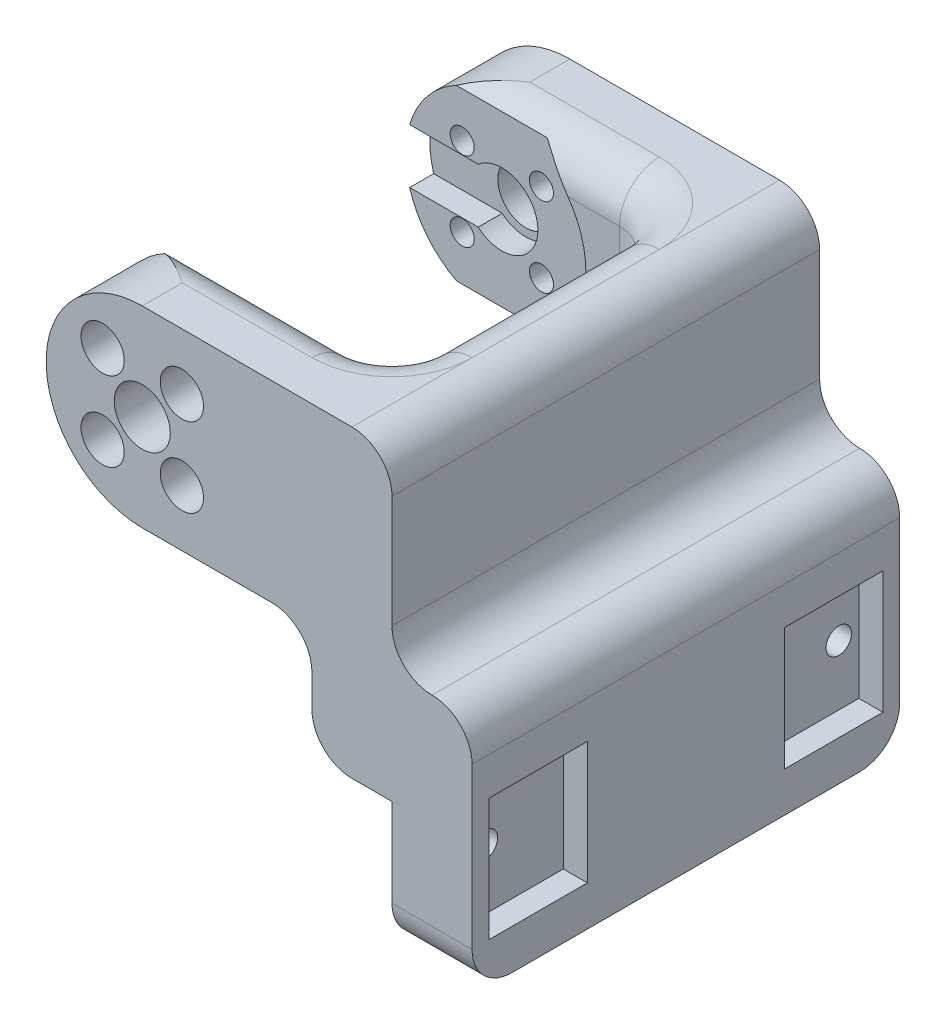
from build123d import *

# Parameters (mm, degrees)
EXTRUDE_1_DEPTH      = 13.5
SKETCH_5_R           = 10.1
CUT_EXTRUDE_2_DEPTH  = 1.5
SKETCH_7_R           = 3.5
CUT_EXTRUDE_3_DEPTH  = 37
SKETCH_35_R          = 4.5
CUT_EXTRUDE_22_DEPTH = 3
SKETCH_9_R           = 1.5
CUT_EXTRUDE_4_DEPTH  = 24.5
SKETCH_11_W          = 60.4
SKETCH_11_H          = 24
EXTRUDE_2_DEPTH      = 10
SKETCH_12_R          = 2.7
CUT_EXTRUDE_5_DEPTH  = 8.5
SKETCH_18_R          = 12
CUT_EXTRUDE_9_DEPTH  = 1.5
SKETCH_19_W          = 16.628747166
SKETCH_19_H          = 6.8
CUT_EXTRUDE_10_DEPTH = 3
SKETCH_20_W          = 76.507524202
SKETCH_20_H          = 37.102074034
CUT_EXTRUDE_11_DEPTH = 3.5
SKETCH_21_W          = 10
SKETCH_21_H          = 53.4
EXTRUDE_3_DEPTH      = 30
SKETCH_22_W          = 53.4
SKETCH_22_H          = 54
EXTRUDE_4_DEPTH      = 15
SKETCH_24_W          = 12.3
SKETCH_24_H          = 15.3
CUT_EXTRUDE_12_DEPTH = 3
SKETCH_26_R          = 1.6
CUT_EXTRUDE_14_DEPTH = 15
SKETCH_27_W          = 15
SKETCH_27_H          = 53.4
CUT_EXTRUDE_15_DEPTH = 24
SKETCH_25_W          = 53.4
SKETCH_25_H          = 16
CUT_EXTRUDE_16_DEPTH = 15
SKETCH_28_W          = 53.4
SKETCH_28_H          = 16
SKETCH_28_R          = 1.6
EXTRUDE_5_DEPTH      = 10
SKETCH_29_W          = 12.3
SKETCH_29_H          = 15.3
SKETCH_29_R          = 1.6
CUT_EXTRUDE_17_DEPTH = 10
SKETCH_30_W          = 53.4
SKETCH_30_H          = 30
CUT_EXTRUDE_18_DEPTH = 10
EXTRUDE_6_DEPTH      = 5
SKETCH_32_W          = 53.4
SKETCH_32_H          = 24
CUT_EXTRUDE_19_DEPTH = 5
FILLET_7_R           = 5
FILLET_8_R           = 5
FILLET_9_R           = 5
FILLET_10_R          = 5


# Some blends are built 0.0001 mm under size
with BuildPart() as part:
    # 草图1 → 凸台-拉伸1 (new body)
    with BuildSketch(Plane.XY):
        with BuildLine():
            Line((0, 12), (36.185307738, 12))
            Line((36.185307738, 12), (36.185307738, -12))
            Line((36.185307738, -12), (0, -12))
            ThreePointArc((0, -12), (-12, 0), (0, 12))
        make_face()
    extrude(amount=EXTRUDE_1_DEPTH)

    # 草图5 → 切除-拉伸2 (cut)
    with BuildSketch(Plane(origin=(0, 0, 0), x_dir=(-1, 0, 0), z_dir=(0, 0, -1))):
        Circle(SKETCH_5_R)
    extrude(amount=-CUT_EXTRUDE_2_DEPTH, mode=Mode.SUBTRACT)

    # 草图7 → 切除-拉伸3 (cut)
    with BuildSketch(Plane(origin=(0, 0, 1.5), x_dir=(-1, 0, 0), z_dir=(0, 0, -1))):
        Circle(SKETCH_7_R)
    extrude(amount=-CUT_EXTRUDE_3_DEPTH, mode=Mode.SUBTRACT)

    # 草图35 → 切除-拉伸22 (cut)
    with BuildSketch(Plane(origin=(0, 0, 1.5), x_dir=(-1, 0, 0), z_dir=(0, 0, -1))):
        Circle(SKETCH_35_R)
    extrude(amount=-CUT_EXTRUDE_22_DEPTH, mode=Mode.SUBTRACT)

    # 草图9 → 切除-拉伸4 (cut)
    with BuildSketch(Plane(origin=(0, 0, 1.5), x_dir=(-1, 0, 0), z_dir=(0, 0, -1))):
        with Locations((-4.949747468, 4.949747468)):
            Circle(SKETCH_9_R)
        with Locations((4.949747468, 4.949747468)):
            Circle(SKETCH_9_R)
        with Locations((4.949747468, -4.949747468)):
            Circle(SKETCH_9_R)
        with Locations((-4.949747468, -4.949747468)):
            Circle(SKETCH_9_R)
    extrude(amount=-CUT_EXTRUDE_4_DEPTH, mode=Mode.SUBTRACT)


with BuildPart() as body_2:
    # 镜向14: mirrored copy
    add(part.part.mirror(Plane(origin=(0, 0, -16.7), x_dir=(1, 0, 0), z_dir=(0, 0, -1))))


with BuildPart() as part_1:
    add(part.part)

    add(body_2.part)  # 凸台-拉伸2 merges body 2
    # 草图11 → 凸台-拉伸2 (add)
    with BuildSketch(Plane(origin=(36.185307738, 0, 0), x_dir=(0, 0, -1), z_dir=(1, 0, 0))):
        with Locations((16.7, 0)):
            Rectangle(SKETCH_11_W, SKETCH_11_H)
    extrude(amount=-EXTRUDE_2_DEPTH)

    # 草图12 → 切除-拉伸5 (cut)
    with BuildSketch(Plane.XY.offset(13.5)):
        with Locations((4.949747468, 4.949747468)):
            Circle(SKETCH_12_R)
        with Locations((4.949747468, -4.949747468)):
            Circle(SKETCH_12_R)
        with Locations((-4.949747468, -4.949747468)):
            Circle(SKETCH_12_R)
        with Locations((-4.949747468, 4.949747468)):
            Circle(SKETCH_12_R)
    cut_extrude_5 = extrude(amount=-CUT_EXTRUDE_5_DEPTH, mode=Mode.SUBTRACT)

    # 草图18 → 切除-拉伸9 (cut)
    with BuildSketch(Plane(origin=(0, 0, 0), x_dir=(-1, 0, 0), z_dir=(0, 0, -1))):
        Circle(SKETCH_18_R)
    cut_extrude_9 = extrude(amount=-CUT_EXTRUDE_9_DEPTH, mode=Mode.SUBTRACT)

    # 草图19 → 切除-拉伸10 (cut)
    with BuildSketch(Plane(origin=(0, 0, 1.5), x_dir=(-1, 0, 0), z_dir=(0, 0, -1))):
        with Locations((8.314373583, 0)):
            Rectangle(SKETCH_19_W, SKETCH_19_H)
    cut_extrude_10 = extrude(amount=-CUT_EXTRUDE_10_DEPTH, mode=Mode.SUBTRACT)

    # 草图20 → 切除-拉伸11 (cut)
    with BuildSketch(Plane.XY.offset(13.5)):
        with Locations((20.283666709, 0.248055891)):
            Rectangle(SKETCH_20_W, SKETCH_20_H)
    cut_extrude_11 = extrude(amount=-CUT_EXTRUDE_11_DEPTH, mode=Mode.SUBTRACT)

    # 镜向24: 切除-拉伸5, 切除-拉伸9, 切除-拉伸10 across plane
    add(cut_extrude_5.mirror(Plane(origin=(0, 0, -16.7), x_dir=(1, 0, 0), z_dir=(0, 0, -1))), mode=Mode.SUBTRACT)
    add(cut_extrude_9.mirror(Plane(origin=(0, 0, -16.7), x_dir=(1, 0, 0), z_dir=(0, 0, -1))), mode=Mode.SUBTRACT)
    add(cut_extrude_10.mirror(Plane(origin=(0, 0, -16.7), x_dir=(1, 0, 0), z_dir=(0, 0, -1))), mode=Mode.SUBTRACT)

    # 镜向26: 切除-拉伸11 across plane
    add(cut_extrude_11.mirror(Plane(origin=(0, 0, -16.7), x_dir=(1, 0, 0), z_dir=(0, 0, -1))), mode=Mode.SUBTRACT)

    # 草图21 → 凸台-拉伸3 (add)
    with BuildSketch(Plane.XZ.offset(12)):
        with Locations((31.185307738, -16.7)):
            Rectangle(SKETCH_21_W, SKETCH_21_H)
    extrude(amount=EXTRUDE_3_DEPTH)

    # 草图22 → 凸台-拉伸4 (add)
    with BuildSketch(Plane(origin=(36.185307738, 0, 0), x_dir=(0, 0, -1), z_dir=(1, 0, 0))):
        with Locations((16.7, -15)):
            Rectangle(SKETCH_22_W, SKETCH_22_H)
    extrude(amount=EXTRUDE_4_DEPTH)

    # 草图24 → 切除-拉伸12 (cut)
    with BuildSketch(Plane(origin=(51.185307738, 0, 0), x_dir=(0, 0, -1), z_dir=(1, 0, 0))):
        with Locations((35.15, -29.35)):
            Rectangle(SKETCH_24_W, SKETCH_24_H)
        with Locations((-1.75, -29.35)):
            Rectangle(SKETCH_24_W, SKETCH_24_H)
    extrude(amount=-CUT_EXTRUDE_12_DEPTH, mode=Mode.SUBTRACT)

    # 草图26 → 切除-拉伸14 (cut)
    with BuildSketch(Plane(origin=(48.185307738, 0, 0), x_dir=(0, 0, -1), z_dir=(1, 0, 0))):
        with Locations((38.8, -29.5)):
            Circle(SKETCH_26_R)
        with Locations(Location((-5.4, -29.5, 0), (0, 0, 180))):
            Circle(SKETCH_26_R)
    extrude(amount=-CUT_EXTRUDE_14_DEPTH, mode=Mode.SUBTRACT)

    # 草图27 → 切除-拉伸15 (cut)
    with BuildSketch(Plane(origin=(0, 12, 0), x_dir=(1, 0, 0), z_dir=(0, 1, 0))):
        with Locations((43.685307738, 16.7)):
            Rectangle(SKETCH_27_W, SKETCH_27_H)
    extrude(amount=-CUT_EXTRUDE_15_DEPTH, mode=Mode.SUBTRACT)

    # 草图25 → 切除-拉伸16 (cut)
    with BuildSketch(Plane.ZY.offset(-26.185307738)):
        with Locations((-16.7, -34)):
            Rectangle(SKETCH_25_W, SKETCH_25_H)
    extrude(amount=-CUT_EXTRUDE_16_DEPTH, mode=Mode.SUBTRACT)

    # 草图28 → 凸台-拉伸5 (add)
    with BuildSketch(Plane.ZY.offset(-41.185307738)):
        with Locations((-16.7, -34)):
            Rectangle(SKETCH_28_W, SKETCH_28_H)
        with Locations((5.4, -29.5)):
            Circle(SKETCH_28_R, mode=Mode.SUBTRACT)
        with Locations(Location((-38.8, -29.5, 0), (0, 0, 180))):
            Circle(SKETCH_28_R, mode=Mode.SUBTRACT)
    extrude(amount=EXTRUDE_5_DEPTH)

    # 草图29 → 切除-拉伸17 (cut)
    # profile 1 of 2: a face of its own
    with BuildSketch(Plane(origin=(48.185307738, 0, 0), x_dir=(0, 0, -1), z_dir=(1, 0, 0))):
        with Locations((-1.75, -29.35)):
            Rectangle(SKETCH_29_W, SKETCH_29_H)
        with Locations((-5.4, -29.5)):
            Circle(SKETCH_29_R, mode=Mode.SUBTRACT)
    # profile 2 of 2: a face of its own
    with BuildSketch(Plane(origin=(48.185307738, 0, 0), x_dir=(0, 0, -1), z_dir=(1, 0, 0))):
        with Locations((35.15, -29.35)):
            Rectangle(SKETCH_29_W, SKETCH_29_H)
        with Locations((38.8, -29.5)):
            Circle(SKETCH_29_R, mode=Mode.SUBTRACT)
    extrude(amount=-CUT_EXTRUDE_17_DEPTH, mode=Mode.SUBTRACT)

    # 草图30 → 切除-拉伸18 (cut)
    with BuildSketch(Plane(origin=(51.185307738, 0, 0), x_dir=(0, 0, -1), z_dir=(1, 0, 0))):
        with Locations((16.7, -27)):
            Rectangle(SKETCH_30_W, SKETCH_30_H)
    extrude(amount=-CUT_EXTRUDE_18_DEPTH, mode=Mode.SUBTRACT)

    # 草图31 → 凸台-拉伸6 (add)
    with BuildSketch(Plane.ZY.offset(-26.185307738)):
        Polygon((-43.4, -12), (-43.4, -26), (10, -26), (10, -12), (0, -12), (0, 12), (-33.4, 12), (-33.4, -12), align=None)
    extrude(amount=EXTRUDE_6_DEPTH)

    # 草图32 → 切除-拉伸19 (cut)
    with BuildSketch(Plane(origin=(36.185307738, 0, 0), x_dir=(0, 0, -1), z_dir=(1, 0, 0))):
        with Locations((16.7, 0)):
            Rectangle(SKETCH_32_W, SKETCH_32_H)
    extrude(amount=-CUT_EXTRUDE_19_DEPTH, mode=Mode.SUBTRACT)

    # 圆角7
    # the kernel refuses this fillet: 5 mm, written as the material it takes off along each edge
    with BuildSketch(Plane(origin=(21.185307738, -12, 0), x_dir=(0, 0, 1), z_dir=(-1, 0, 0))) as fillet_7_piece_1:
        with BuildLine():
            CenterArc((FILLET_7_R, FILLET_7_R), FILLET_7_R, 180, 90)
            Line((0, FILLET_7_R), (0, 0))
            Line((0, 0), (FILLET_7_R, 0))
        make_face()
    extrude(amount=33.685307738, mode=Mode.SUBTRACT)
    with BuildSketch(Plane(origin=(21.185307738, -12, -33.4), x_dir=(0, 0, -1), z_dir=(-1, 0, 0))) as fillet_7_piece_2:
        with BuildLine():
            CenterArc((FILLET_7_R, -FILLET_7_R), FILLET_7_R, 90, 90)
            Line((0, -FILLET_7_R), (0, 0))
            Line((0, 0), (FILLET_7_R, 0))
        make_face()
    extrude(amount=33.685307738, mode=Mode.SUBTRACT)
    # the kernel refuses this fillet: 5 mm, written as the material it adds along each edge
    with BuildSketch(Plane(origin=(21.185307738, -12, -38.4), x_dir=(0, -1, 0), z_dir=(0, 0, -1)), Plane(origin=(21.185307738, -12, 10), x_dir=(0, -1, 0), z_dir=(0, 0, -1))) as fillet_7_2_piece_1:
        with BuildLine():
            CenterArc((FILLET_7_R, FILLET_7_R), FILLET_7_R, 180, 90)
            Line((0, FILLET_7_R), (0, 0))
            Line((0, 0), (FILLET_7_R, 0))
        make_face()
    extrude(amount=5)
    with BuildSketch(Plane(origin=(21.185307738, -7, 0), x_dir=(-1, 0, 0), z_dir=(0, 1, 0))) as fillet_7_2_piece_2:
        with BuildLine():
            CenterArc((FILLET_7_R, -FILLET_7_R), FILLET_7_R, 90, 90)
            Line((0, -FILLET_7_R), (0, 0))
            Line((0, 0), (FILLET_7_R, 0))
        make_face()
    extrude(amount=19)
    with BuildSketch(Plane(origin=(21.185307738, 12, -33.4), x_dir=(0, 0, 1), z_dir=(0, -1, 0))) as fillet_7_2_piece_3:
        with BuildLine():
            CenterArc((FILLET_7_R, FILLET_7_R), FILLET_7_R, 180, 90)
            Line((0, FILLET_7_R), (0, 0))
            Line((0, 0), (FILLET_7_R, 0))
        make_face()
    extrude(amount=19)
    with BuildSketch(Plane(origin=(21.185307738, -7, -38.4), x_dir=(0, -1, 0), z_dir=(0, 0, -1))) as fillet_7_2_piece_4:
        with BuildLine():
            CenterArc((5 + FILLET_7_R, FILLET_7_R), FILLET_7_R, 180, 90)
            Line((5, FILLET_7_R), (5, 0))
            Line((5, 0), (5 + FILLET_7_R, 0))
        make_face()
    revolve(axis=Axis((21.185307738, -7, -38.4), (-1, 0, 0)), revolution_arc=90)
    with BuildSketch(Plane(origin=(21.185307738, -7, 5), x_dir=(0, -1, 0), z_dir=(0, 0, 1))) as fillet_7_2_piece_5:
        with BuildLine():
            CenterArc((5 + FILLET_7_R, -FILLET_7_R), FILLET_7_R, 90, 90)
            Line((5, -FILLET_7_R), (5, 0))
            Line((5, 0), (5 + FILLET_7_R, 0))
        make_face()
    revolve(axis=Axis((21.185307738, -7, 5), (1, 0, 0)), revolution_arc=90)
    # the kernel refuses this fillet: 5 mm, written as the material it takes off along each edge
    with BuildSketch(Plane(origin=(-12.5, 12, 0), x_dir=(0, 0, 1), z_dir=(1, 0, 0))) as fillet_7_3_piece_1:
        with BuildLine():
            CenterArc((FILLET_7_R, FILLET_7_R), FILLET_7_R, 180, 90)
            Line((0, FILLET_7_R), (0, 0))
            Line((0, 0), (FILLET_7_R, 0))
        make_face()
    extrude(amount=28.685307738, mode=Mode.SUBTRACT)
    with BuildSketch(Plane(origin=(-12.5, 12, -33.4), x_dir=(0, 0, -1), z_dir=(1, 0, 0))) as fillet_7_3_piece_2:
        with BuildLine():
            CenterArc((FILLET_7_R, -FILLET_7_R), FILLET_7_R, 90, 90)
            Line((0, -FILLET_7_R), (0, 0))
            Line((0, 0), (FILLET_7_R, 0))
        make_face()
    extrude(amount=28.685307738, mode=Mode.SUBTRACT)
    with BuildSketch(Plane(origin=(21.185307738, 12, -5), x_dir=(1, 0, 0), z_dir=(0, 0, -1))) as fillet_7_3_piece_3:
        with BuildLine():
            CenterArc((FILLET_7_R, FILLET_7_R), FILLET_7_R, 180, 90)
            Line((0, FILLET_7_R), (0, 0))
            Line((0, 0), (FILLET_7_R, 0))
        make_face()
    extrude(amount=23.4, mode=Mode.SUBTRACT)
    with BuildSketch(Plane(origin=(16.185307738, 12, -5), x_dir=(0, 0, 1), z_dir=(-1, 0, 0))) as fillet_7_3_piece_4:
        with BuildLine():
            CenterArc((5 + FILLET_7_R, -FILLET_7_R), FILLET_7_R, 90, 90)
            Line((5, -FILLET_7_R), (5, 0))
            Line((5, 0), (5 + FILLET_7_R, 0))
        make_face()
    revolve(axis=Axis((16.185307738, 12, -5), (0, 1, 0)), revolution_arc=90, mode=Mode.SUBTRACT)
    with BuildSketch(Plane(origin=(16.185307738, 12, -28.4), x_dir=(1, 0, 0), z_dir=(0, 0, 1))) as fillet_7_3_piece_5:
        with BuildLine():
            CenterArc((5 + FILLET_7_R, -FILLET_7_R), FILLET_7_R, 90, 90)
            Line((5, -FILLET_7_R), (5, 0))
            Line((5, 0), (5 + FILLET_7_R, 0))
        make_face()
    revolve(axis=Axis((16.185307738, 12, -28.4), (0, 1, 0)), revolution_arc=90, mode=Mode.SUBTRACT)

    # 圆角8
    fillet_8_edges = [part_1.edges().sort_by_distance(p)[0] for p in [
        (21.185307738, -26, -16.7),
        (31.185307738, 12, -16.7),
        (31.185307738, -12, -16.7),
    ]]
    fillet(fillet_8_edges, radius=FILLET_8_R - 0.0001)  # a hair under: the kernel refuses the full size

    # 圆角9
    fillet_9_edges = [part_1.edges().sort_by_distance(p)[0] for p in [
        (36.185307738, -42, -43.4),
        (36.185307738, -42, 10),
    ]]
    fillet(fillet_9_edges, radius=FILLET_9_R)

    # 圆角10
    fillet_10_edges = [part_1.edges().sort_by_distance(p)[0] for p in [
        (41.185307738, -12, -16.7),
    ]]
    fillet(fillet_10_edges, radius=FILLET_10_R)


solid = part_1.part
